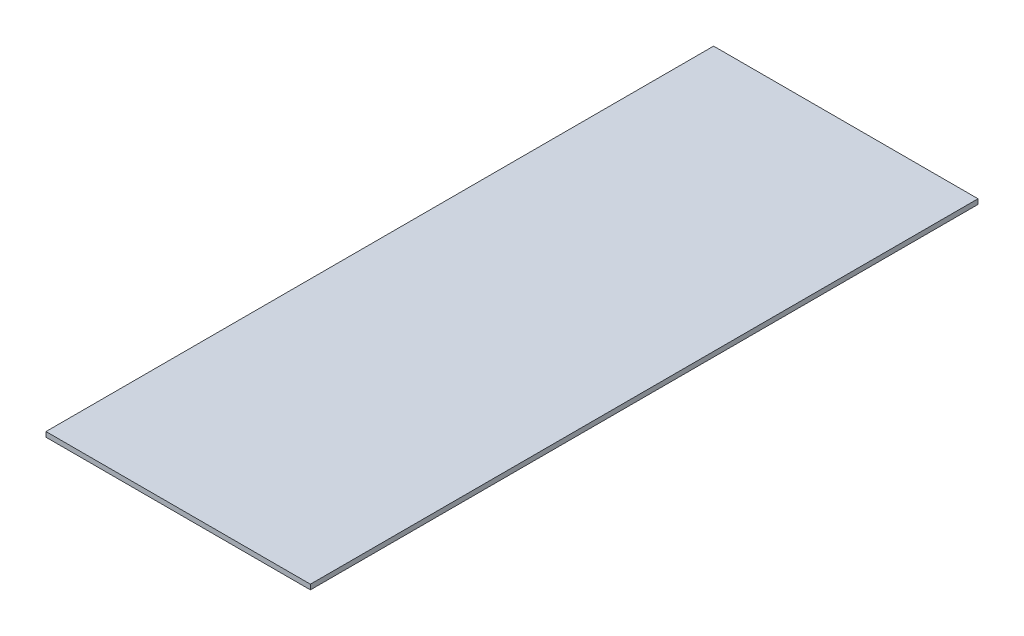
from build123d import *

# Parameters (mm, degrees)
SKETCH1_W           = 160
SKETCH1_H           = 404
BOSS_EXTRUDE1_DEPTH = 3


with BuildPart() as part:
    # Sketch1 → Boss-Extrude1 (new body)
    with BuildSketch(Plane(origin=(0, 0, 0.047945548), x_dir=(1, 0, 0), z_dir=(0, 1, 0))):
        with Locations((47.787450107, -2.079150986)):
            Rectangle(SKETCH1_W, SKETCH1_H)
    extrude(amount=BOSS_EXTRUDE1_DEPTH)


solid = part.part
